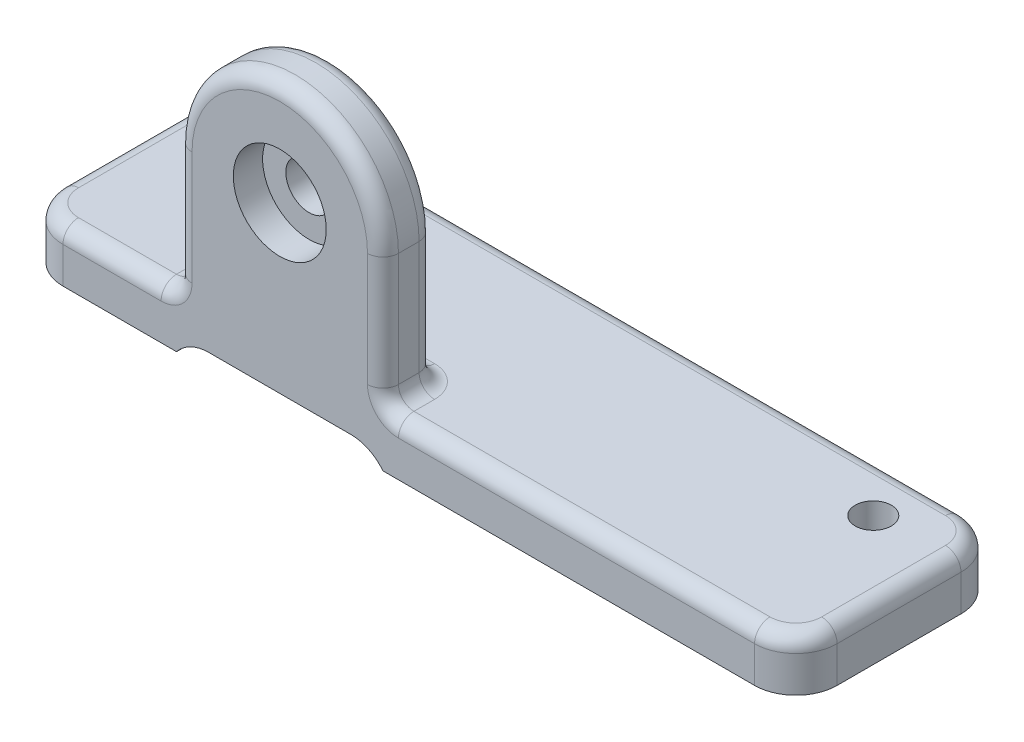
from build123d import *

# Parameters (mm, degrees)
SKETCH_1_W                   = 150
SKETCH_1_H                   = 40
BASEPLATE_DEPTH              = 10
VERTBOSS_DEPTH               = 10
SKETCH_3_W                   = 40
SKETCH_3_H                   = 3
BOTTOMSOLT_DEPTH             = 165.69669092
HOLE_WIZARD_M8_1_D           = 9
HOLE_WIZARD_M8_1_CBORE_D     = 18.01
HOLE_WIZARD_M8_1_CBORE_DEPTH = 5.68
HOLE_WIZARD_7_0_7_1_D        = 7
FILLET_1_R                   = 8
FILLET_2_R                   = 3


with BuildPart() as part:
    # 草圖1 → BasePlate (new body)
    with BuildSketch(Plane(origin=(0, 0, 0), x_dir=(1, 0, 0), z_dir=(0, 1, 0))):
        with Locations((75, 20)):
            Rectangle(SKETCH_1_W, SKETCH_1_H)
    extrude(amount=BASEPLATE_DEPTH)

    # 草圖2 → VertBoss (add)
    with BuildSketch(Plane.XY):
        with BuildLine():
            Line((30, 0), (30, 35))
            ThreePointArc((30, 35), (50, 55), (70, 35))
            Line((70, 35), (70, 0))
            Line((70, 0), (30, 0))
        make_face()
    extrude(amount=-VERTBOSS_DEPTH)

    # 草圖3 → BottomSolt (cut, through all)
    with BuildSketch(Plane.XY):
        with Locations((50, 1.5)):
            Rectangle(SKETCH_3_W, SKETCH_3_H)
    extrude(amount=-BOTTOMSOLT_DEPTH, mode=Mode.SUBTRACT)

    # M8 六角頭螺栓的柱孔1 (through all)
    with Locations(Plane.XY):
        with Locations((50, 35)):
            CounterBoreHole(HOLE_WIZARD_M8_1_D / 2, HOLE_WIZARD_M8_1_CBORE_D / 2, HOLE_WIZARD_M8_1_CBORE_DEPTH)

    # Ø7.0 (7) 直徑孔1 (through all)
    with Locations(Plane(origin=(0, 10, 0), x_dir=(1, 0, 0), z_dir=(0, 1, 0))):
        with Locations((15, 30), (135, 30)):
            Hole(HOLE_WIZARD_7_0_7_1_D / 2)

    # 圓角1
    # the kernel refuses this fillet: 8 mm, written as the material it adds along each edge
    with BuildSketch(Plane(origin=(70, 3, 0), x_dir=(-1, 0, 0), z_dir=(0, 0, -1))) as fillet_1_piece_1:
        with BuildLine():
            CenterArc((6.244997998, -8), FILLET_1_R, 90, 51.317812547)
            Line((0, -3), (0, 0))
            Line((0, 0), (6.244997998, 0))
        make_face()
    extrude(amount=40)
    with BuildSketch(Plane(origin=(30, 3, 0), x_dir=(0, -1, 0), z_dir=(0, 0, -1))) as fillet_1_piece_2:
        with BuildLine():
            CenterArc((8, -6.244997998), FILLET_1_R, 128.682187453, 51.317812547)
            Line((0, -6.244997998), (0, 0))
            Line((0, 0), (3, 0))
        make_face()
    extrude(amount=40)
    # the kernel refuses this fillet: 8 mm, written as the material it takes off along each edge
    with BuildSketch(Plane(origin=(0, -20, 0), x_dir=(1, 0, 0), z_dir=(0, 1, 0)), Plane(origin=(0, -20, -40), x_dir=(0, 0, 1), z_dir=(0, 1, 0))) as fillet_1_2_piece_1:
        with BuildLine():
            CenterArc((FILLET_1_R, FILLET_1_R), FILLET_1_R, 180, 90)
            Line((0, FILLET_1_R), (0, 0))
            Line((0, 0), (FILLET_1_R, 0))
        make_face()
    extrude(amount=50, mode=Mode.SUBTRACT)
    with BuildSketch(Plane(origin=(150, -20, 0), x_dir=(-1, 0, 0), z_dir=(0, 1, 0)), Plane(origin=(150, -20, -40), x_dir=(0, 0, 1), z_dir=(0, 1, 0))) as fillet_1_2_piece_2:
        with BuildLine():
            CenterArc((FILLET_1_R, -FILLET_1_R), FILLET_1_R, 90, 90)
            Line((0, -FILLET_1_R), (0, 0))
            Line((0, 0), (FILLET_1_R, 0))
        make_face()
    extrude(amount=50, mode=Mode.SUBTRACT)

    # 圓角2
    fillet_2_edges = [part.edges().sort_by_distance(p)[0] for p in [
        (106, 10, 0),
        (30, 22.5, -10),
        (70, 22.5, -10),
        (30, 22.5, 0),
        (70, 22.5, 0),
        (50, 55, 0),
        (30, 10, -5),
        (50, 55, -10),
        (70, 10, -5),
        (50, 10, -10),
        (19, 10, 0),
        (0, 10, -20),
        (150, 10, -20),
        (75, 10, -40),
        (147.656854249, 10, -37.656854249),
        (147.656854249, 10, -2.343145751),
        (2.343145751, 10, -37.656854249),
        (2.343145751, 10, -2.343145751),
    ]]
    fillet(fillet_2_edges, radius=FILLET_2_R)


solid = part.part
